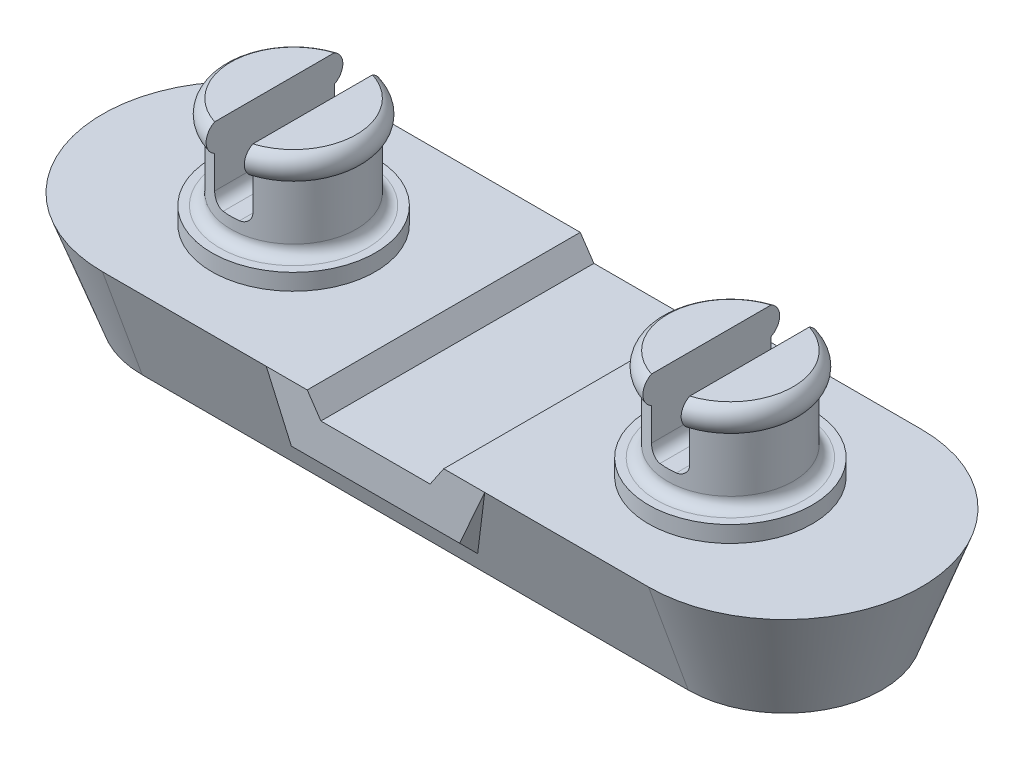
from build123d import *

# Parameters (mm, degrees)
BOSS_EXTRUDE1_DEPTH     = 4
BOSS_EXTRUDE1_DRAFT     = -20
SKETCH3_W               = 1.4
SKETCH3_H               = 6
CUT_EXTRUDE1_DEPTH      = 17.309506455
FILLET1_R               = 0.4
FILLET1_OF_MIRROR1_R    = 0.4
BOSS_EXTRUDE2_DEPTH     = 5
CHAMFER1_SIZE           = 1.338525748
CHAMFER1_SIZE_2         = 0.8
CUT_EXTRUDE2_DEPTH      = 17.309506455
CUT_EXTRUDE2_DEPTH_BACK = 17.309506455


with BuildPart() as part:
    # Sketch1 → Boss-Extrude1 (with draft: the straight prism first)
    with BuildSketch(Plane(origin=(0, 0, 0), x_dir=(1, 0, 0), z_dir=(0, 1, 0))):
        with BuildLine():
            ThreePointArc((-10, 5), (-15, 0), (-10, -5))
            Line((-10, -5), (10, -5))
            ThreePointArc((10, -5), (15, 0), (10, 5))
            Line((10, 5), (-10, 5))
        make_face()
    extrude(amount=-BOSS_EXTRUDE1_DEPTH)
    # Boss-Extrude1: the draft: its side faces are tilted about the plane it starts from
    boss_extrude1_sides = [part.faces().sort_by_distance(p)[0] for p in [
        (-15, -2, 0),
        (0, -2, 5),
        (15, -2, 0),
        (0, -2, -5),
    ]]
    draft(boss_extrude1_sides, Plane(origin=(0, 0, 0), x_dir=(1, 0, 0), z_dir=(0, 1, 0)), BOSS_EXTRUDE1_DRAFT)

    # Sketch2 → Revolve1 (revolve)
    with BuildSketch(Plane.XY, mode=Mode.PRIVATE) as revolve1_sk:
        with BuildLine():
            Line((-5, 0), (-8, 0))
            Line((-8, 0), (-8, 4))
            Line((-8, 4), (-5.7, 4))
            ThreePointArc((-5.7, 4), (-5.4, 3.5), (-5.7, 3))
            Line((-5.7, 3), (-5.7, 0.6))
            Line((-5.7, 0.6), (-5, 0.6))
            Line((-5, 0.6), (-5, 0))
        make_face()
    revolve1 = revolve(revolve1_sk.sketch.rotate(Axis((-8, 4.406807082, 0), (0, -1, 0)), 180), axis=Axis((-8, 4.406807082, 0), (0, -1, 0)))

    # Sketch3 → Cut-Extrude1 (cut, symmetric)
    with BuildSketch(Plane.XY):
        with Locations((-8, 4.406807082)):
            Rectangle(SKETCH3_W, SKETCH3_H)
    cut_extrude1 = extrude(amount=CUT_EXTRUDE1_DEPTH, both=True, mode=Mode.SUBTRACT)

    # Fillet1
    fillet1_edges = [part.edges().sort_by_distance(p)[0] for p in [
        (-5.7, 0.6, 0),
        (-7.3, 1.406807082, 0),
        (-8.7, 1.406807082, 0),
    ]]
    fillet(fillet1_edges, radius=FILLET1_R)

    # Mirror1: Revolve1, Cut-Extrude1 across plane
    add(revolve1.mirror(Plane(origin=(0, 0, 0), x_dir=(0, 0, 1), z_dir=(1, 0, 0))))
    add(cut_extrude1.mirror(Plane(origin=(0, 0, 0), x_dir=(0, 0, 1), z_dir=(1, 0, 0))), mode=Mode.SUBTRACT)

    # Fillet1 of Mirror1
    fillet1_of_mirror1_edges = [part.edges().sort_by_distance(p)[0] for p in [
        (5.7, 0.6, 0),
        (7.3, 1.406807082, 0),
        (8.7, 1.406807082, 0),
    ]]
    fillet(fillet1_of_mirror1_edges, radius=FILLET1_OF_MIRROR1_R)

    # Sketch4 → Boss-Extrude2 (add, symmetric)
    with BuildSketch(Plane.XY):
        Polygon((-4, 0), (4, 0), (3.114229495, -2), (-3.114229495, -2), align=None)
    extrude(amount=BOSS_EXTRUDE2_DEPTH, both=True)

    # Chamfer1
    # the kernel refuses this chamfer: 1.338525748, 0.8 mm, written as the material it adds along each edge
    with BuildSketch(Plane(origin=(6.582316876, -2, 4.272059531), x_dir=(0, -0.9339888612507298, -0.3573021229429867), z_dir=(-1, 0, 0))) as chamfer1_piece_1_section:
        Polygon((CHAMFER1_SIZE * 0.999866964174, CHAMFER1_SIZE * 0.0163111641321), (-CHAMFER1_SIZE_2 * 0.357302122943, CHAMFER1_SIZE_2 * 0.933988861251), (0, 0), align=None)
    chamfer1_piece_1 = extrude(amount=13.164633752, mode=Mode.PRIVATE)
    chamfer1_piece_1 = split(chamfer1_piece_1, bisect_by=Plane(origin=(-2.45134628, -3.496738063, 4.375919387), z_dir=(0.9143398734593109, 0.40494764575486975, 0)), keep=Keep.TOP, mode=Mode.PRIVATE)
    chamfer1_piece_1 = split(chamfer1_piece_1, bisect_by=Plane(origin=(2.45134628, -3.496738063, 4.375919387), z_dir=(-0.914339873459311, 0.40494764575486936, 0)), keep=Keep.TOP, mode=Mode.PRIVATE)
    chamfer1_piece_1 = split(chamfer1_piece_1, bisect_by=Plane(origin=(0, -2.411072946, 5), z_dir=(0, 0, -1)), keep=Keep.TOP, mode=Mode.PRIVATE)
    add(chamfer1_piece_1)
    with BuildSketch(Plane(origin=(-6.582316876, -2, -4.272059531), x_dir=(0, -0.9339888612507298, 0.3573021229429865), z_dir=(1, 0, 0))) as chamfer1_piece_2_section:
        Polygon((CHAMFER1_SIZE * 0.999866964174, CHAMFER1_SIZE * 0.0163111641321), (-CHAMFER1_SIZE_2 * 0.357302122943, CHAMFER1_SIZE_2 * 0.933988861251), (0, 0), align=None)
    chamfer1_piece_2 = extrude(amount=13.164633752, mode=Mode.PRIVATE)
    chamfer1_piece_2 = split(chamfer1_piece_2, bisect_by=Plane(origin=(2.45134628, -3.496738063, -4.375919387), z_dir=(-0.914339873459311, 0.40494764575486936, 0)), keep=Keep.TOP, mode=Mode.PRIVATE)
    chamfer1_piece_2 = split(chamfer1_piece_2, bisect_by=Plane(origin=(-2.45134628, -3.496738063, -4.375919387), z_dir=(0.9143398734593109, 0.40494764575486975, 0)), keep=Keep.TOP, mode=Mode.PRIVATE)
    chamfer1_piece_2 = split(chamfer1_piece_2, bisect_by=Plane(origin=(0, -2.411072946, -5), z_dir=(0, 0, 1)), keep=Keep.TOP, mode=Mode.PRIVATE)
    add(chamfer1_piece_2)

    # Sketch5 → Cut-Extrude2 (cut, two sides: drawn at the far end of the back side and taken through both)
    with BuildSketch(Plane.XY.offset(-CUT_EXTRUDE2_DEPTH_BACK)):
        Polygon((-2.5, 0), (2.5, 0), (2, -0.735655285), (-2, -0.735655285), align=None)
    extrude(amount=CUT_EXTRUDE2_DEPTH + CUT_EXTRUDE2_DEPTH_BACK, mode=Mode.SUBTRACT)


solid = part.part
